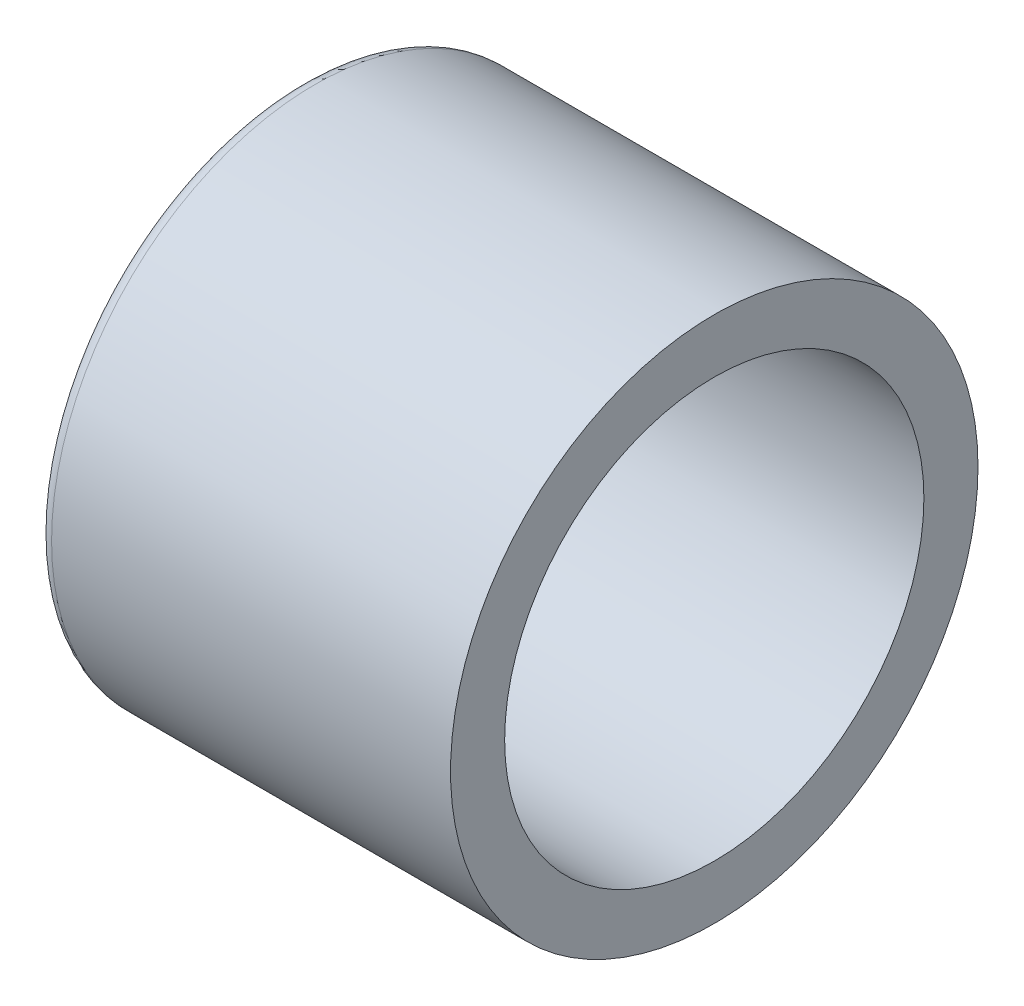
from build123d import *

# Parameters (mm, degrees)
FILLET1_R     = 2
CHAMFER1_SIZE = 1


with BuildPart() as part:
    # Sketch1 → Revolve1 (revolve)
    with BuildSketch(Plane.XY):
        Polygon((-30.5, 39), (30.5, 39), (30.5, 31), (-26.5, 31), (-26.5, 28.5), (-30.5, 28.5), align=None)
    revolve(axis=Axis((88.99, 0, 0), (-1, 0, 0)))

    # Fillet1
    fillet1_edges = [part.edges().sort_by_distance(p)[0] for p in [
        (-30.5, -39, 0),
    ]]
    fillet(fillet1_edges, radius=FILLET1_R)

    # Chamfer1
    chamfer1_edges = [part.edges().sort_by_distance(p)[0] for p in [
        (-30.5, -28.5, 0),
    ]]
    chamfer(chamfer1_edges, length=CHAMFER1_SIZE)


solid = part.part
